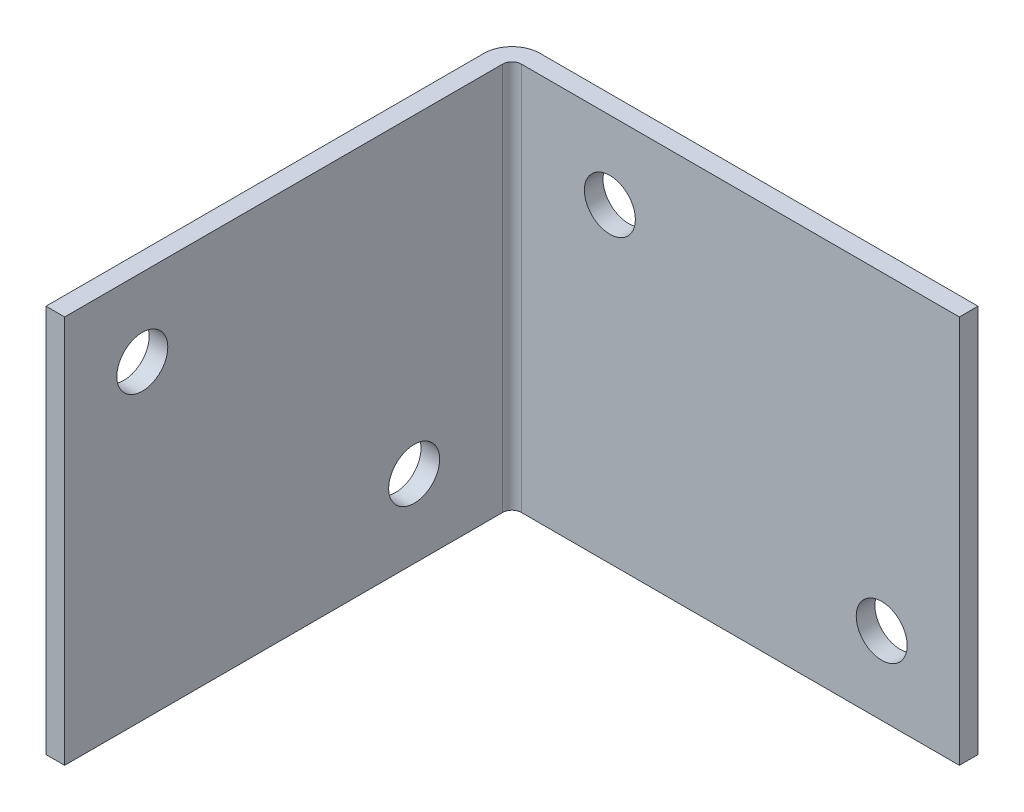
from build123d import *

# Parameters (mm, degrees)
EXTRUDE_THIN1_START = -15.875
EXTRUDE_THIN1_DEPTH = 31.75
SKETCH4_R           = 2.0828
EXTRUDE3_DEPTH      = 56.149155941
CIRPATTERN1_COUNT   = 2


# Read off the part's stored shape, not the designer's step: Extrude-Thin1
with BuildPart() as part:
    # Extrude-Thin1 outline → Extrude-Thin1 (new body)
    with BuildSketch(Plane(origin=(0, 0, 0), x_dir=(1, 0, 0), z_dir=(0, 1, 0)).offset(EXTRUDE_THIN1_START)):
        with BuildLine():
            Line((2.286, -1.524), (38.1, -1.524))
            Line((38.1, -1.524), (38.1, 0))
            Line((38.1, 0), (2.286, 0))
            ThreePointArc((2.286, 0), (0.669553898, -0.669553898), (0, -2.286))
            Line((0, -2.286), (0, -38.1))
            Line((0, -38.1), (1.524, -38.1))
            Line((1.524, -38.1), (1.524, -2.286))
            ThreePointArc((1.524, -2.286), (1.747184633, -1.747184633), (2.286, -1.524))
        make_face()
    extrude(amount=EXTRUDE_THIN1_DEPTH)

    # Sketch4 → Extrude3 (cut, through all)
    with BuildSketch(Plane(origin=(1.524, 0, 0), x_dir=(0, 0, -1), z_dir=(1, 0, 0))):
        with Locations((-31.75, 60.325)):
            Circle(SKETCH4_R)
        with Locations((-9.525, 41.275)):
            Circle(SKETCH4_R)
        with Locations((-9.525, -9.525)):
            Circle(SKETCH4_R)
        with Locations((-31.75, 9.525)):
            Circle(SKETCH4_R)
    extrude3 = extrude(amount=-EXTRUDE3_DEPTH, mode=Mode.SUBTRACT)

    # CirPattern1: Extrude3 ×2 about axis
    cirpattern1_axis = Axis((0, 0, 0), (0.7071067811865464, 0, 0.7071067811865487))
    for i in range(1, CIRPATTERN1_COUNT):
        add(extrude3.rotate(cirpattern1_axis, i * 360 / CIRPATTERN1_COUNT), mode=Mode.SUBTRACT)


solid = part.part
